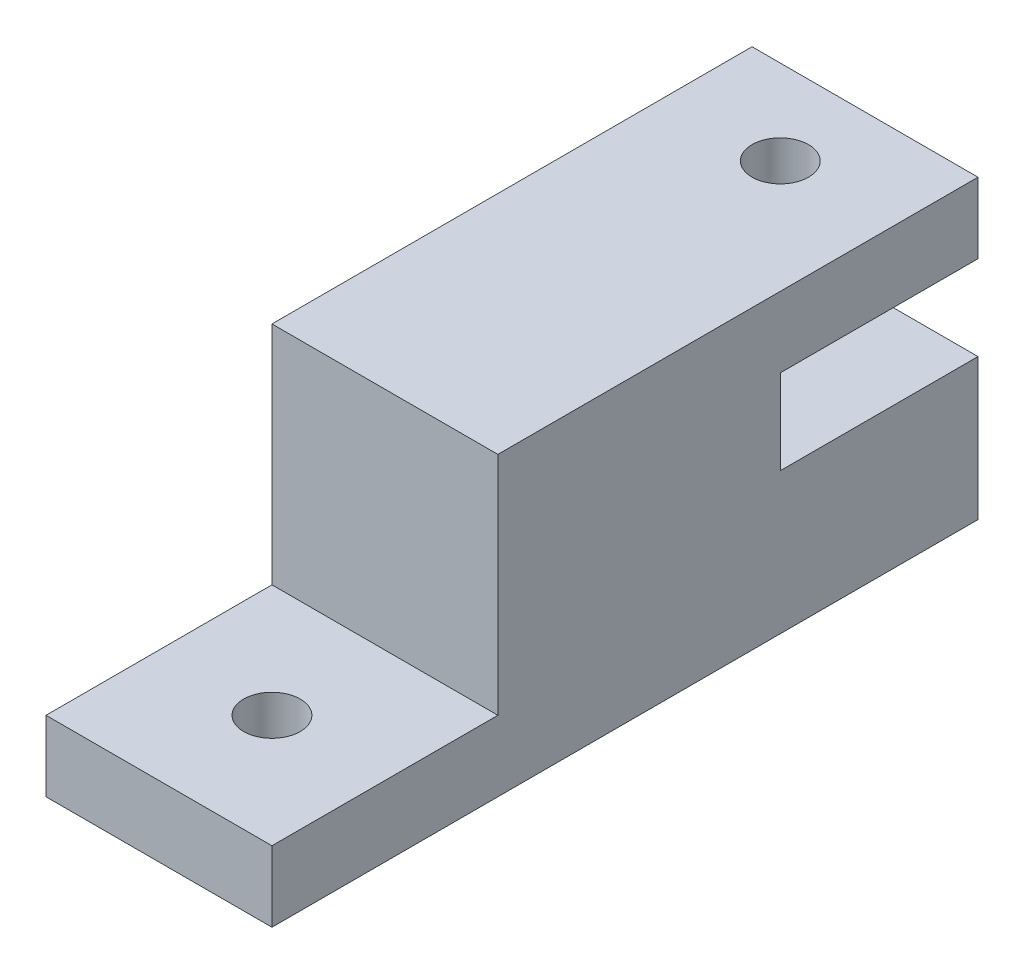
from build123d import *

# Parameters (mm, degrees)
BOSS_EXTRUDE1_DEPTH = 12.7
SKETCH2_R           = 3.175
CUT_EXTRUDE1_DEPTH  = 65.699146295


with BuildPart() as part:
    # Sketch1 → Boss-Extrude1 (new, symmetric)
    with BuildSketch(Plane(origin=(0, 0, 0), x_dir=(0, 0, -1), z_dir=(1, 0, 0))):
        Polygon((0, 0), (-25.4, 0), (-25.4, -7.9375), (53.975, -7.9375), (53.975, 7.9375), (31.75, 7.9375), (31.75, 17.4625), (53.975, 17.4625), (53.975, 25.4), (0, 25.4), align=None)
    extrude(amount=BOSS_EXTRUDE1_DEPTH, both=True)

    # Sketch2 → Cut-Extrude1 (cut, through all)
    with BuildSketch(Plane(origin=(0, 25.4, 0), x_dir=(1, 0, 0), z_dir=(0, 1, 0))):
        with Locations((0, 44.45)):
            Circle(SKETCH2_R)
        with Locations((0, -12.7)):
            Circle(SKETCH2_R)
    extrude(amount=-CUT_EXTRUDE1_DEPTH, mode=Mode.SUBTRACT)


solid = part.part
